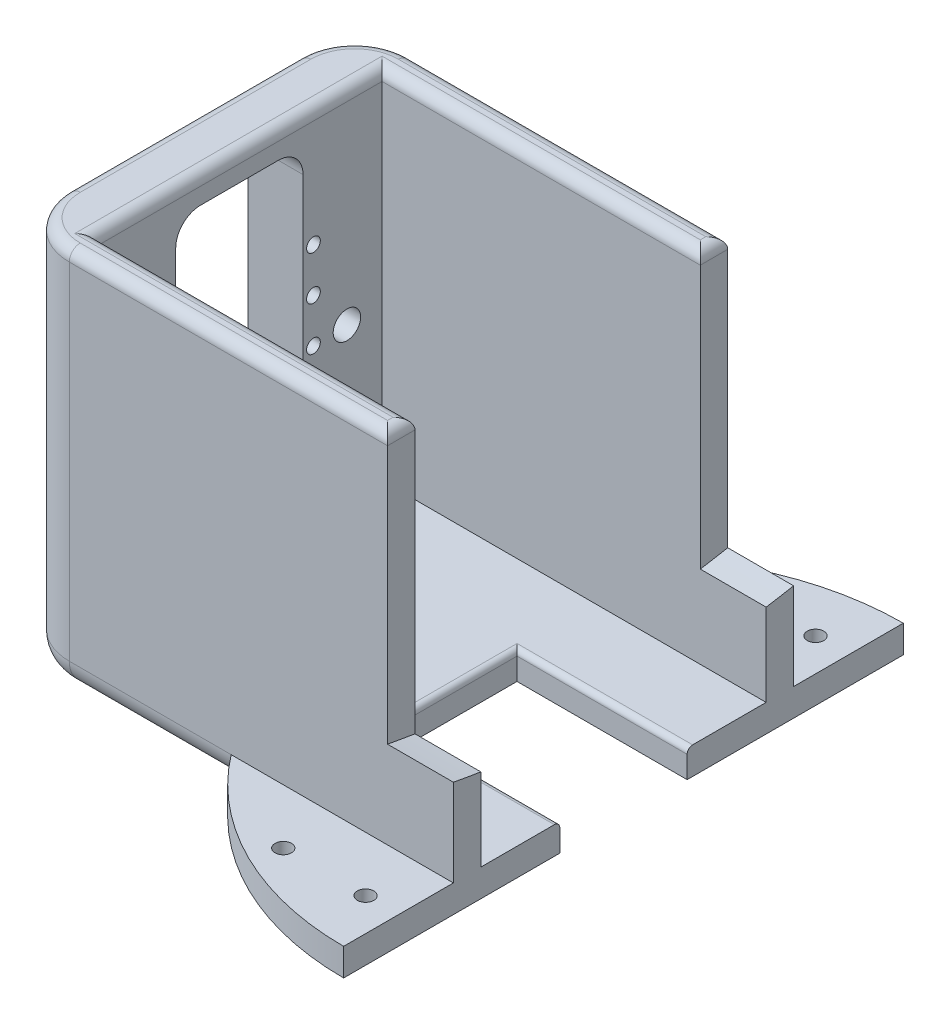
from build123d import *

# Parameters (mm, degrees)
BOSS_EXTRU_5_DEPTH       = 50
ENL_V_MAT_EXTRU_1_DEPTH  = 10
BOSS_EXTRU_6_DEPTH       = 5
ESQUISSE11_R             = 2.5
ENL_V_MAT_EXTRU_9_DEPTH  = 5
CONG_1_R                 = 10
ENL_V_MAT_EXTRU_12_DEPTH = 12
ESQUISSE12_W             = 31
ESQUISSE12_H             = 23.2
ENL_V_MAT_EXTRU_13_DEPTH = 10
CONG_2_R                 = 1
ESQUISSE9_W              = 62
ESQUISSE9_H              = 34.999999956
ENL_V_MAT_EXTRU_14_DEPTH = 110.66312051
CONG_3_R                 = 5
CONG_4_R                 = 2
ESQUISSE13_R             = 1.5
ENL_V_MAT_EXTRU_15_DEPTH = 116.004347813
TROU_TARAUD_M31_D        = 2.5
TROU_TARAUD_M31_DEPTH    = 12.5
TROU_TARAUD_M31_TIP      = 0.751075774


with BuildPart() as part:
    # Esquisse1 → Boss.-Extru.5 (new, symmetric)
    with BuildSketch(Plane(origin=(0, 0, 0), x_dir=(1, 0, 0), z_dir=(0, 1, 0))):
        Polygon((0, 31), (-40.496913463, 31), (-80, 31), (-80, -31), (-40.496913463, -31), (0, -31), (0, -26), (-40.496913463, -26), (-70, -26), (-70, 26), (-40.496913463, 26), (0, 26), align=None)
    extrude(amount=BOSS_EXTRU_5_DEPTH, both=True)

    # Esquisse5 → Enlèv. mat.-Extru.1 (cut)
    with BuildSketch(Plane(origin=(-70, 0, 0), x_dir=(0, 0, -1), z_dir=(1, 0, 0))):
        with BuildLine():
            Line((-11.59999996, 5.499999956), (-11.59999996, -33.8))
            Line((-11.59999996, -33.8), (11.60000004, -33.8))
            Line((11.60000004, -33.8), (11.60000004, 5.500000044))
            ThreePointArc((11.60000004, 5.500000044), (10.281980555, 8.68198056), (7.10000004, 10.000000044))
            Line((7.10000004, 10.000000044), (-7.099999871, 10.000000044))
            ThreePointArc((-7.099999871, 10.000000044), (-10.281980449, 8.681980534), (-11.59999996, 5.499999956))
        make_face()
    extrude(amount=-ENL_V_MAT_EXTRU_1_DEPTH, mode=Mode.SUBTRACT)

    # Esquisse8 → Boss.-Extru.6 (add)
    with BuildSketch(Plane(origin=(0, -50, 0), x_dir=(1, 0, 0), z_dir=(0, 1, 0))):
        with BuildLine():
            Line((0, -50.999999907), (0, 50.999999907))
            ThreePointArc((0, 50.999999907), (-22.584882388, 45.728136811), (-40.5, 31))
            Line((-40.5, 31), (-80, 31))
            Line((-80, 31), (-80, -31))
            Line((-80, -31), (-40.5, -31))
            ThreePointArc((-40.5, -31), (-22.584882388, -45.728136811), (0, -50.999999907))
        make_face()
    extrude(amount=-BOSS_EXTRU_6_DEPTH)

    # Esquisse11 → Enlèv. mat.-Extru.9 (cut)
    with BuildSketch(Plane(origin=(-70, 0, 0), x_dir=(0, 0, -1), z_dir=(1, 0, 0))):
        with Locations((-19.59999996, -22.213953621)):
            Circle(ESQUISSE11_R)
        with Locations((19.59999996, -22.213953621)):
            Circle(ESQUISSE11_R)
    extrude(amount=-ENL_V_MAT_EXTRU_9_DEPTH, mode=Mode.SUBTRACT)

    # Congé1
    cong_1_edges = [part.edges().sort_by_distance(p)[0] for p in [
        (-80, -2.5, 31),
        (-80, -2.5, -31),
    ]]
    fillet(cong_1_edges, radius=CONG_1_R)

    # Esquisse10 → Enlèv. mat.-Extru.12 (cut)
    with BuildSketch(Plane(origin=(0, 0, 0), x_dir=(0, 0, -1), z_dir=(1, 0, 0))):
        with BuildLine():
            Line((136.28713183, 33.486696785), (85.263165158, 65.69401727))
            ThreePointArc((85.263165158, 65.69401727), (69.088826466, 48.564130721), (49.552191154, 35.397425514))
            ThreePointArc((49.552191154, 35.397425514), (-14.729470129, 24.226140009), (-73.513371624, 52.534840476))
            ThreePointArc((-73.513371624, 52.534840476), (-79.660455319, 58.871393898), (-85.263165158, 65.69401727))
            Line((-85.263165158, 65.69401727), (-136.28713183, 33.486696785))
            ThreePointArc((-136.28713183, 33.486696785), (0, -37), (136.28713183, 33.486696785))
        make_face()
    extrude(amount=-ENL_V_MAT_EXTRU_12_DEPTH, mode=Mode.SUBTRACT)

    # Esquisse12 → Enlèv. mat.-Extru.13 (cut)
    with BuildSketch(Plane(origin=(0, -55, 0), x_dir=(-1, 0, 0), z_dir=(0, -1, 0))):
        with Locations((15.5, 0)):
            Rectangle(ESQUISSE12_W, ESQUISSE12_H)
    extrude(amount=-ENL_V_MAT_EXTRU_13_DEPTH, mode=Mode.SUBTRACT)

    # Congé2
    cong_2_edges = [part.edges().sort_by_distance(p)[0] for p in [
        (-15.5, -50, -11.6),
        (-31, -50, 0),
        (-15.5, -50, 11.6),
    ]]
    fillet(cong_2_edges, radius=CONG_2_R)

    # Esquisse9 → Enlèv. mat.-Extru.14 (cut, through all)
    with BuildSketch(Plane(origin=(0, 0, 0), x_dir=(0, 0, -1), z_dir=(1, 0, 0))):
        with Locations((0, 32.500000022)):
            Rectangle(ESQUISSE9_W, ESQUISSE9_H)
    extrude(amount=-ENL_V_MAT_EXTRU_14_DEPTH, mode=Mode.SUBTRACT)

    # Congé3
    cong_3_edges = [part.edges().sort_by_distance(p)[0] for p in [
        (-55.25, -55, 31),
        (-77.071067812, -55, 28.071067812),
        (-80, -55, 0),
        (-77.071067812, -55, -28.071067812),
        (-55.25, -55, -31),
    ]]
    fillet(cong_3_edges, radius=CONG_3_R)

    # Congé4
    cong_4_edges = [part.edges().sort_by_distance(p)[0] for p in [
        (-12, 15.000000044, -28.5),
        (-41, 15.000000044, -26),
        (-41, 15.000000044, -31),
        (-77.071067812, 15.000000044, -28.071067812),
        (-80, 15.000000044, 0),
        (-77.071067812, 15.000000044, 28.071067812),
        (-70, 15.000000044, 0),
        (-41, 15.000000044, 26),
        (-41, 15.000000044, 31),
        (-12, 15.000000044, 28.5),
    ]]
    fillet(cong_4_edges, radius=CONG_4_R)

    # Esquisse13 → Enlèv. mat.-Extru.15 (cut, through all)
    with BuildSketch(Plane(origin=(0, -50, 0), x_dir=(1, 0, 0), z_dir=(0, 1, 0))):
        with Locations((-21, 40.999999953)):
            Circle(ESQUISSE13_R)
        with Locations((-6, 40.999999953)):
            Circle(ESQUISSE13_R)
        with Locations((-6, -40.999999953)):
            Circle(ESQUISSE13_R)
        with Locations((-21, -40.999999953)):
            Circle(ESQUISSE13_R)
    extrude(amount=-ENL_V_MAT_EXTRU_15_DEPTH, mode=Mode.SUBTRACT)

    # Trou taraudé M31
    with Locations(Plane(origin=(-70, -6.5, 13.5), x_dir=(0, 0, 1), z_dir=(1, 0, 0))):
        with Locations((0, 0), (-27, 0), (-27, 8), (0, 8), (0, 16), (-27, 16), (-27, 24), (0, 24)):
            Hole(TROU_TARAUD_M31_D / 2, depth=TROU_TARAUD_M31_DEPTH)
            with Locations((0, 0, -(TROU_TARAUD_M31_DEPTH + TROU_TARAUD_M31_TIP / 2))):  # 118° drill point
                Cone(0, TROU_TARAUD_M31_D / 2, TROU_TARAUD_M31_TIP, mode=Mode.SUBTRACT)


solid = part.part
